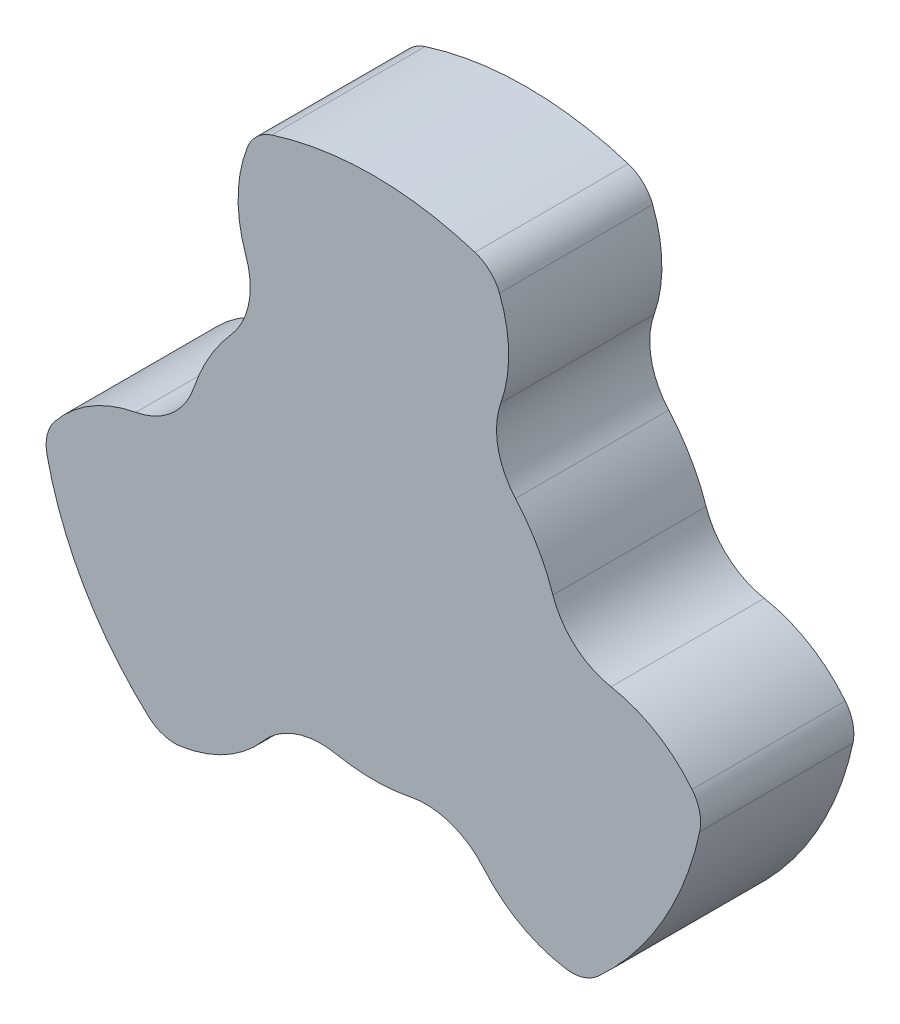
from build123d import *

# Parameters (mm, degrees)
BOSS_EXTRUDE1_DEPTH = 12.7


with BuildPart() as part:
    # Sketch1 → Boss-Extrude1 (new body)
    with BuildSketch(Plane.XY):
        with BuildLine():
            ThreePointArc((19.09558361, -27.286492755), (15.377016657, -28.688589019), (12.38097626, -31.299595732))
            ThreePointArc((12.38097626, -31.299595732), (11.754813891, -32.585358585), (11.743487691, -34.015441499))
            ThreePointArc((11.743487691, -34.015441499), (14.816954296, -41.959391499), (20.1598835, -48.593066656))
            ThreePointArc((20.1598835, -48.593066656), (21.404034733, -49.298299337), (22.830619211, -49.398908245))
            ThreePointArc((22.830619211, -49.398908245), (26.589837552, -48.109764507), (29.663372012, -45.590439192))
            ThreePointArc((29.663372012, -45.590439192), (32.39282557, -43.727845578), (35.689842925, -43.506829177))
            ThreePointArc((35.689842925, -43.506829177), (38.793733625, -43.816700713), (41.897624325, -43.506829177))
            ThreePointArc((41.897624325, -43.506829177), (45.194641681, -43.727845578), (47.924095238, -45.590439192))
            ThreePointArc((47.924095238, -45.590439192), (50.997629698, -48.109764507), (54.75684804, -49.398908245))
            ThreePointArc((54.75684804, -49.398908245), (56.183432518, -49.298299337), (57.427583751, -48.593066656))
            ThreePointArc((57.427583751, -48.593066656), (62.770512955, -41.959391499), (65.84397956, -34.015441499))
            ThreePointArc((65.84397956, -34.015441499), (65.83265336, -32.585358585), (65.206490991, -31.299595732))
            ThreePointArc((65.206490991, -31.299595732), (62.210450594, -28.688589019), (58.491883641, -27.286492755))
            ThreePointArc((58.491883641, -27.286492755), (55.514103476, -25.854013443), (53.67418898, -23.109220856))
            ThreePointArc((53.67418898, -23.109220856), (52.390600252, -20.266236892), (50.57029828, -17.733124463))
            ThreePointArc((50.57029828, -17.733124463), (49.11319542, -14.767315476), (49.361522028, -11.47224255))
            ThreePointArc((49.361522028, -11.47224255), (50.006554521, -7.550820971), (49.243376577, -3.650670519))
            ThreePointArc((49.243376577, -3.650670519), (48.442954467, -2.465516575), (47.210129434, -1.740666341))
            ThreePointArc((47.210129434, -1.740666341), (38.793733625, -0.430391499), (30.377337817, -1.740666341))
            ThreePointArc((30.377337817, -1.740666341), (29.144512783, -2.465516575), (28.344090674, -3.650670519))
            ThreePointArc((28.344090674, -3.650670519), (27.58091273, -7.550820971), (28.225945223, -11.47224255))
            ThreePointArc((28.225945223, -11.47224255), (28.47427183, -14.767315476), (27.01716897, -17.733124463))
            ThreePointArc((27.01716897, -17.733124463), (25.196866999, -20.266236892), (23.91327827, -23.109220856))
            ThreePointArc((23.91327827, -23.109220856), (22.073363775, -25.854013443), (19.09558361, -27.286492755))
        make_face()
    extrude(amount=BOSS_EXTRUDE1_DEPTH)


solid = part.part
